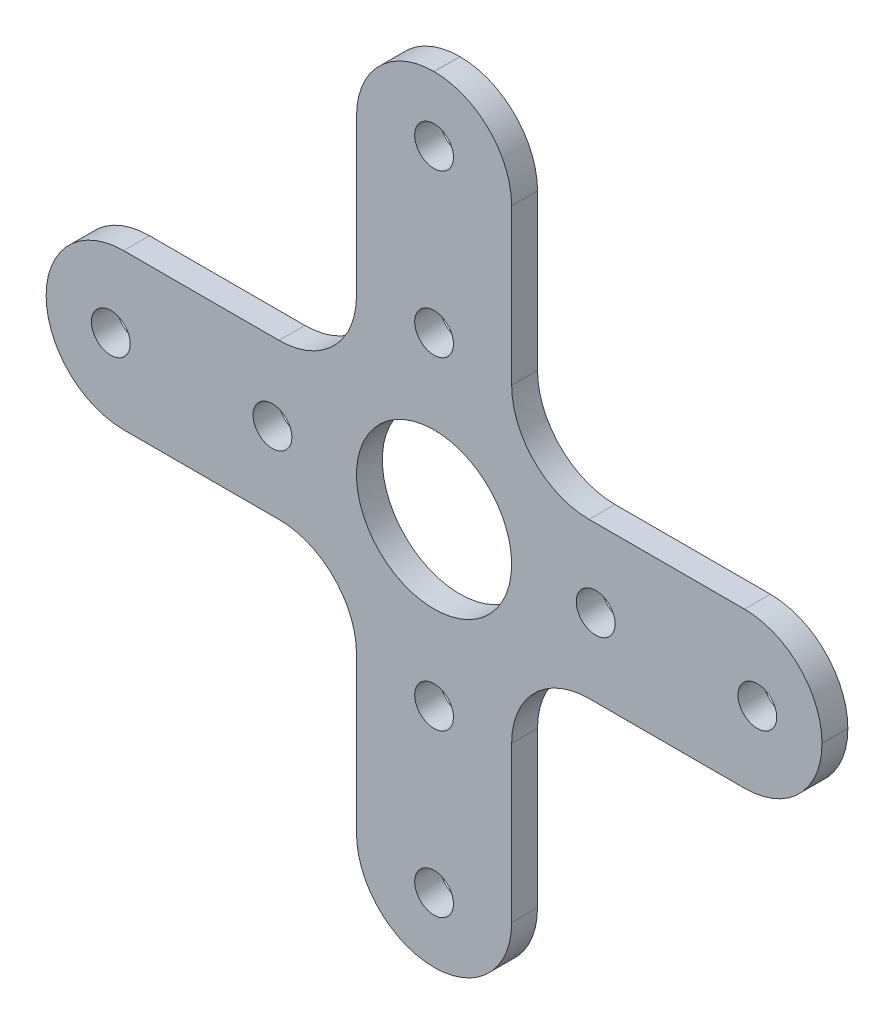
from build123d import *

# Parameters (mm, degrees)
SKETCH1_R           = 6
SKETCH1_R_2         = 1.5
BOSS_EXTRUDE1_DEPTH = 2


with BuildPart() as part:
    # Sketch1 → Boss-Extrude1 (new body)
    with BuildSketch(Plane.XY):
        with BuildLine():
            Line((11.99, -6), (24.01, -6))
            ThreePointArc((24.01, -6), (28.245569619, -4.245569619), (30, -0.01))
            Line((30, -0.01), (30, 0.01))
            ThreePointArc((30, 0.01), (28.245569619, 4.245569619), (24.01, 6))
            Line((24.01, 6), (11.99, 6))
            ThreePointArc((11.99, 6), (7.754430381, 7.754430381), (6, 11.99))
            Line((6, 11.99), (6, 24.01))
            ThreePointArc((6, 24.01), (4.245569619, 28.245569619), (0.01, 30))
            Line((0.01, 30), (-0.01, 30))
            ThreePointArc((-0.01, 30), (-4.245569619, 28.245569619), (-6, 24.01))
            Line((-6, 24.01), (-6, 11.99))
            ThreePointArc((-6, 11.99), (-7.754430381, 7.754430381), (-11.99, 6))
            Line((-11.99, 6), (-24.01, 6))
            ThreePointArc((-24.01, 6), (-28.245569619, 4.245569619), (-30, 0.01))
            Line((-30, 0.01), (-30, -0.01))
            ThreePointArc((-30, -0.01), (-28.245569619, -4.245569619), (-24.01, -6))
            Line((-24.01, -6), (-11.99, -6))
            ThreePointArc((-11.99, -6), (-7.754430381, -7.754430381), (-6, -11.99))
            Line((-6, -11.99), (-6, -24.01))
            ThreePointArc((-6, -24.01), (-4.245569619, -28.245569619), (-0.01, -30))
            Line((-0.01, -30), (0.01, -30))
            ThreePointArc((0.01, -30), (4.245569619, -28.245569619), (6, -24.01))
            Line((6, -24.01), (6, -11.99))
            ThreePointArc((6, -11.99), (7.754430381, -7.754430381), (11.99, -6))
        make_face()
        Circle(SKETCH1_R, mode=Mode.SUBTRACT)
        with Locations((-25, 0)):
            Circle(SKETCH1_R_2, mode=Mode.SUBTRACT)
        with Locations((25, 0)):
            Circle(SKETCH1_R_2, mode=Mode.SUBTRACT)
        with Locations((0, 25)):
            Circle(SKETCH1_R_2, mode=Mode.SUBTRACT)
        with Locations((0, -25)):
            Circle(SKETCH1_R_2, mode=Mode.SUBTRACT)
        with Locations((0, 12.5)):
            Circle(SKETCH1_R_2, mode=Mode.SUBTRACT)
        with Locations((0, -12.5)):
            Circle(SKETCH1_R_2, mode=Mode.SUBTRACT)
        with Locations((-12.5, 0)):
            Circle(SKETCH1_R_2, mode=Mode.SUBTRACT)
        with Locations((12.5, 0)):
            Circle(SKETCH1_R_2, mode=Mode.SUBTRACT)
    extrude(amount=BOSS_EXTRUDE1_DEPTH)


solid = part.part
